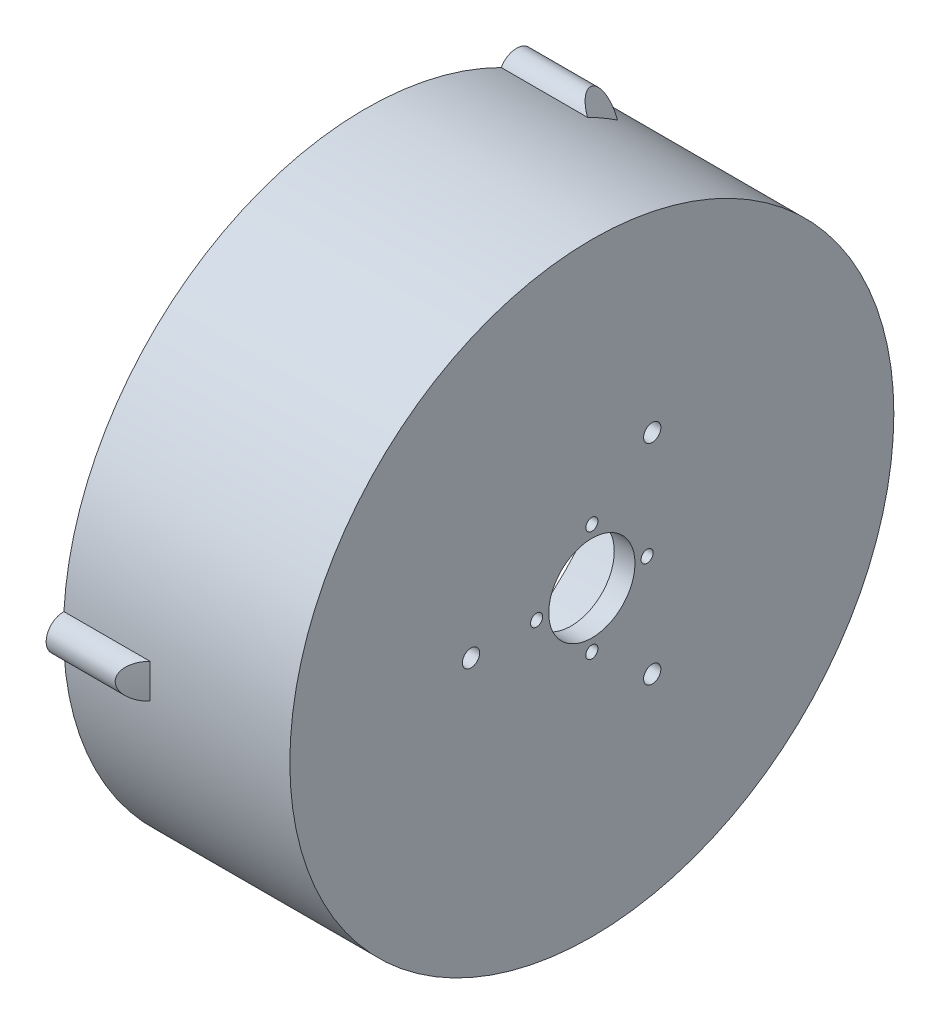
from build123d import *

# Parameters (mm, degrees)
SKETCH3_R           = 12.5
CUT_EXTRUDE2_DEPTH  = 30
SKETCH4_R           = 5
BOSS_EXTRUDE1_DEPTH = 15
SKETCH5_R           = 2.5
CUT_EXTRUDE3_DEPTH  = 10.5
CIRPATTERN1_COUNT   = 3
CHAMFER1_SIZE       = 10
CHAMFER2_SIZE       = 10
CHAMFER3_SIZE       = 10
SKETCH6_R           = 1.75
CUT_EXTRUDE4_DEPTH  = 10.5
SKETCH7_R           = 2.5
CUT_EXTRUDE5_DEPTH  = 10.5
CIRPATTERN2_COUNT   = 3


with BuildPart() as part:
    # Sketch1 → Revolve1 (revolve)
    with BuildSketch(Plane(origin=(0, 0, 0), x_dir=(-1, 0, 0), z_dir=(0, 1, 0)), mode=Mode.PRIVATE) as revolve1_sk:
        Polygon((0, 0), (0, 87.5), (65.6, 87.5), (65.6, 81.5), (6, 81.5), (6, 0), align=None)
    revolve(revolve1_sk.sketch.rotate(Axis((38.11091851, 0, 0), (-1, 0, 0)), 180), axis=Axis((38.11091851, 0, 0), (-1, 0, 0)))

    # Sketch3 → Cut-Extrude2 (cut)
    with BuildSketch(Plane.YZ):
        with Locations(Location((0, 0, 0), (0, 0, 270))):
            Circle(SKETCH3_R)
    extrude(amount=-CUT_EXTRUDE2_DEPTH, mode=Mode.SUBTRACT)

    # Sketch4 → Boss-Extrude1 (add)
    with BuildSketch(Plane(origin=(-65.6, 0, 0), x_dir=(0, -1, 0), z_dir=(-1, 0, 0))):
        with Locations((0, 87.5)):
            Circle(SKETCH4_R)
        with Locations((-75.777222831, -43.75)):
            Circle(SKETCH4_R)
        with Locations((75.777222831, -43.75)):
            Circle(SKETCH4_R)
    extrude(amount=-BOSS_EXTRUDE1_DEPTH)

    # Sketch5 → Cut-Extrude3 (cut)
    with BuildSketch(Plane(origin=(-65.6, 0, 0), x_dir=(0, -1, 0), z_dir=(-1, 0, 0))):
        with Locations(Location((0, 87.5, 0), (0, 0, 90))):
            Circle(SKETCH5_R)
    cut_extrude3 = extrude(amount=-CUT_EXTRUDE3_DEPTH, mode=Mode.SUBTRACT)

    # CirPattern1: Cut-Extrude3 ×3 about axis
    cirpattern1_axis = Axis((0, 0, 0), (1, 0, 0))
    for i in range(1, CIRPATTERN1_COUNT):
        add(cut_extrude3.rotate(cirpattern1_axis, i * 360 / CIRPATTERN1_COUNT), mode=Mode.SUBTRACT)

    # Chamfer1
    # the kernel refuses this chamfer: 10 mm, written as the material it adds along each edge
    with BuildSketch(Plane(origin=(-50.6, 0, 0), x_dir=(0, 0.9851517122975438, -0.17168606162766187), z_dir=(0, 0.17168606162766187, 0.9851517122975438))) as chamfer1_piece_1_section:
        Polygon((87.5, -CHAMFER1_SIZE), (87.5 + CHAMFER1_SIZE, 0), (87.5, 0), align=None)
    chamfer1_piece_1 = revolve(axis=Axis((-50.6, 0, 0), (-1, 0, 0)), revolution_arc=40.228270546, mode=Mode.PRIVATE)
    chamfer1_piece_1 = chamfer1_piece_1 & Plane(origin=(-46.494939835, 75.777222831, -43.75), x_dir=(0, -1, 0), z_dir=(-1, 0, 0)) * Cylinder(5, 390, mode=Mode.PRIVATE)
    add(chamfer1_piece_1)

    # Chamfer2
    # the kernel refuses this chamfer: 10 mm, written as the material it adds along each edge
    with BuildSketch(Plane(origin=(-50.6, 0, 0), x_dir=(0, -0.3438913653035208, 0.9390094402452408), z_dir=(0, -0.9390094402452408, -0.3438913653035208))) as chamfer2_piece_1_section:
        Polygon((87.5, -CHAMFER2_SIZE), (87.5 + CHAMFER2_SIZE, 0), (87.5, 0), align=None)
    chamfer2_piece_1 = revolve(axis=Axis((-50.6, 0, 0), (-1, 0, 0)), revolution_arc=40.228270546, mode=Mode.PRIVATE)
    chamfer2_piece_1 = chamfer2_piece_1 & Plane(origin=(-46.494939444, 0, 87.5), x_dir=(0, -1, 0), z_dir=(-1, 0, 0)) * Cylinder(5, 390, mode=Mode.PRIVATE)
    add(chamfer2_piece_1)

    # Chamfer3
    # the kernel refuses this chamfer: 10 mm, written as the material it adds along each edge
    with BuildSketch(Plane(origin=(-50.6, 0, 0), x_dir=(0, -0.6412603469940208, -0.7673233786175866), z_dir=(0, 0.7673233786175866, -0.6412603469940208))) as chamfer3_piece_1_section:
        Polygon((87.5, -CHAMFER3_SIZE), (87.5 + CHAMFER3_SIZE, 0), (87.5, 0), align=None)
    chamfer3_piece_1 = revolve(axis=Axis((-50.6, 0, 0), (-1, 0, 0)), revolution_arc=40.228270546, mode=Mode.PRIVATE)
    chamfer3_piece_1 = chamfer3_piece_1 & Plane(origin=(-46.494939164, -75.777222831, -43.75), x_dir=(0, -1, 0), z_dir=(-1, 0, 0)) * Cylinder(5, 390, mode=Mode.PRIVATE)
    add(chamfer3_piece_1)

    # Sketch6 → Cut-Extrude4 (cut)
    with BuildSketch(Plane.YZ):
        with Locations(Location((-16, 0, 0), (0, 0, 270))):
            Circle(SKETCH6_R)
        with Locations(Location((16, 0, 0), (0, 0, 270))):
            Circle(SKETCH6_R)
        with Locations(Location((0, 16, 0), (0, 0, 270))):
            Circle(SKETCH6_R)
        with Locations(Location((0, -16, 0), (0, 0, 270))):
            Circle(SKETCH6_R)
    extrude(amount=-CUT_EXTRUDE4_DEPTH, mode=Mode.SUBTRACT)

    # Sketch7 → Cut-Extrude5 (cut)
    with BuildSketch(Plane.YZ):
        with Locations(Location((0, 35, 0), (0, 0, 270))):
            Circle(SKETCH7_R)
    cut_extrude5 = extrude(amount=-CUT_EXTRUDE5_DEPTH, mode=Mode.SUBTRACT)

    # CirPattern2: Cut-Extrude5 ×3 about axis
    cirpattern2_axis = Axis((0, 0, 0), (1, 0, 0))
    for i in range(1, CIRPATTERN2_COUNT):
        add(cut_extrude5.rotate(cirpattern2_axis, i * 360 / CIRPATTERN2_COUNT), mode=Mode.SUBTRACT)


solid = part.part
